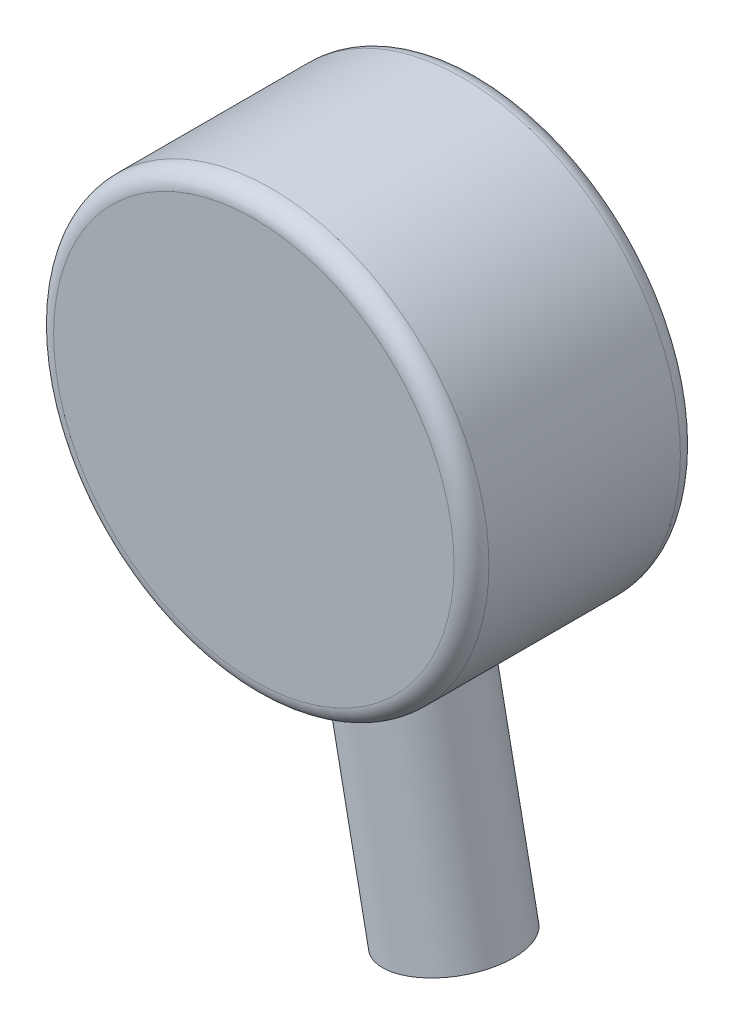
from build123d import *

# Parameters (mm, degrees)
ESQUISSE1_R            = 12.5
BOSS_EXTRU_1_DEPTH     = 13
BOSS_EXTRU_2_START     = 12.5
BOSS_EXTRU_2_OUTLINE_R = 3.5
BOSS_EXTRU_2_DEPTH     = 13
CONG_1_R               = 1


# Read off the part's stored shape, not the designer's step: Boss.-Extru.2
with BuildPart() as part:
    # Esquisse1 → Boss.-Extru.1 (new body)
    with BuildSketch(Plane.XY):
        with Locations(Location((0, 0, 0), (0, 0, 180))):
            Circle(ESQUISSE1_R)
    extrude(amount=BOSS_EXTRU_1_DEPTH)

    # Congé1
    cong_1_edges = [part.edges().sort_by_distance(p)[0] for p in [
        (12.5, 0, 0),
        (12.5, 0, 13),
    ]]
    fillet(cong_1_edges, radius=CONG_1_R)


with BuildPart() as body_2:
    # Boss.-Extru.2 outline → Boss.-Extru.2 (new body)
    with BuildSketch(Plane(origin=(0, 0, 0), x_dir=(0.9807466597819918, 0.19528438065156695, 0), z_dir=(0.19528438065156695, -0.9807466597819918, 0)).offset(BOSS_EXTRU_2_START)):
        with Locations((0, 6.5)):
            Circle(BOSS_EXTRU_2_OUTLINE_R)
    extrude(amount=BOSS_EXTRU_2_DEPTH)


solid = Compound([part.part, body_2.part])
